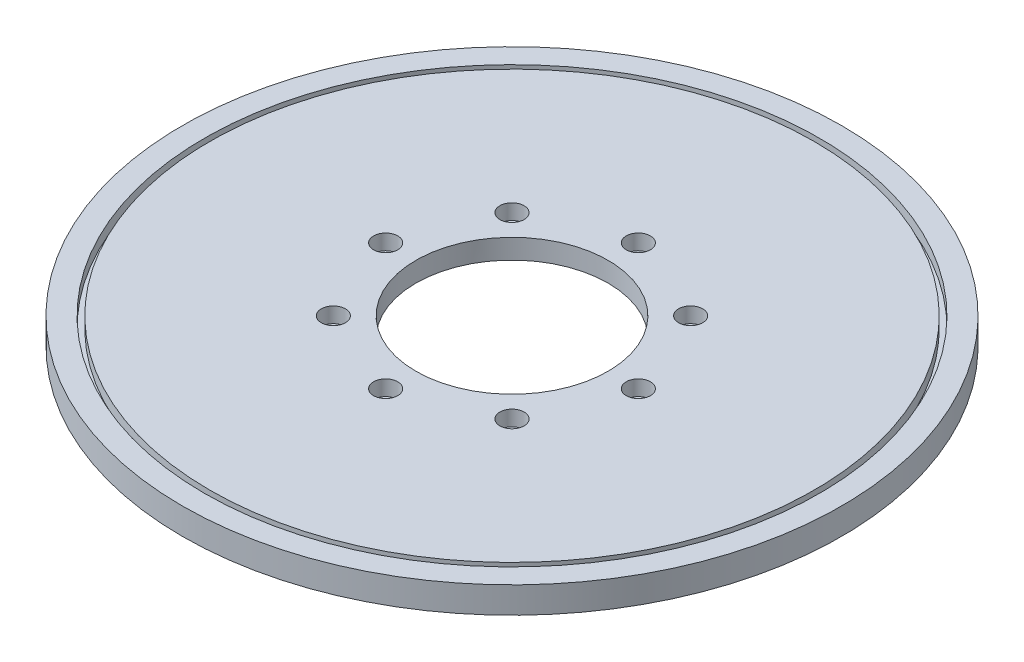
from build123d import *

# Parameters (mm, degrees)
SKETCH1_R          = 300
PLATE_DEPTH        = 24
SKETCH2_R          = 87.5
BEARING_HOLE_DEPTH = 425.942349031
SKETCH4_R          = 280
SKETCH4_R_2        = 275
CUT_EXTRUDE3_DEPTH = 10
SKETCH5_R          = 135
CUT_EXTRUDE4_DEPTH = 6
SKETCH6_R          = 6
CUT_EXTRUDE5_DEPTH = 425.645734701
SKETCH7_R          = 11
CUT_EXTRUDE6_DEPTH = 14


with BuildPart() as part:
    # Sketch1 → plate (new body)
    with BuildSketch(Plane(origin=(0, 0, 0), x_dir=(1, 0, 0), z_dir=(0, 1, 0))):
        Circle(SKETCH1_R)
    extrude(amount=PLATE_DEPTH)

    # Sketch2 → bearing-hole (cut, through all)
    with BuildSketch(Plane(origin=(0, 24, 0), x_dir=(1, 0, 0), z_dir=(0, 1, 0))):
        Circle(SKETCH2_R)
    extrude(amount=-BEARING_HOLE_DEPTH, mode=Mode.SUBTRACT)

    # Sketch4 → Cut-Extrude3 (cut)
    with BuildSketch(Plane(origin=(0, 24, 0), x_dir=(1, 0, 0), z_dir=(0, 1, 0))):
        Circle(SKETCH4_R)
        Circle(SKETCH4_R_2, mode=Mode.SUBTRACT)
    extrude(amount=-CUT_EXTRUDE3_DEPTH, mode=Mode.SUBTRACT)

    # Sketch5 → Cut-Extrude4 (cut)
    with BuildSketch(Plane.XZ):
        Circle(SKETCH5_R)
    extrude(amount=-CUT_EXTRUDE4_DEPTH, mode=Mode.SUBTRACT)

    # Sketch6 → Cut-Extrude5 (cut, through all)
    with BuildSketch(Plane.XZ.offset(-6)):
        with Locations((0, 115)):
            Circle(SKETCH6_R)
        with Locations((81.317279836, 81.317279836)):
            Circle(SKETCH6_R)
        with Locations((115, 0)):
            Circle(SKETCH6_R)
        with Locations((81.317279836, -81.317279836)):
            Circle(SKETCH6_R)
        with Locations((0, -115)):
            Circle(SKETCH6_R)
        with Locations((-81.317279836, -81.317279836)):
            Circle(SKETCH6_R)
        with Locations((-115, 0)):
            Circle(SKETCH6_R)
        with Locations((-81.317279836, 81.317279836)):
            Circle(SKETCH6_R)
    extrude(amount=-CUT_EXTRUDE5_DEPTH, mode=Mode.SUBTRACT)

    # Sketch7 → Cut-Extrude6 (cut)
    with BuildSketch(Plane(origin=(0, 24, 0), x_dir=(1, 0, 0), z_dir=(0, 1, 0))):
        with Locations((0, 115)):
            Circle(SKETCH7_R)
        with Locations((81.317279836, 81.317279836)):
            Circle(SKETCH7_R)
        with Locations((115, 0)):
            Circle(SKETCH7_R)
        with Locations((81.317279836, -81.317279836)):
            Circle(SKETCH7_R)
        with Locations((0, -115)):
            Circle(SKETCH7_R)
        with Locations((-81.317279836, -81.317279836)):
            Circle(SKETCH7_R)
        with Locations((-115, 0)):
            Circle(SKETCH7_R)
        with Locations((-81.317279836, 81.317279836)):
            Circle(SKETCH7_R)
    extrude(amount=-CUT_EXTRUDE6_DEPTH, mode=Mode.SUBTRACT)


solid = part.part
